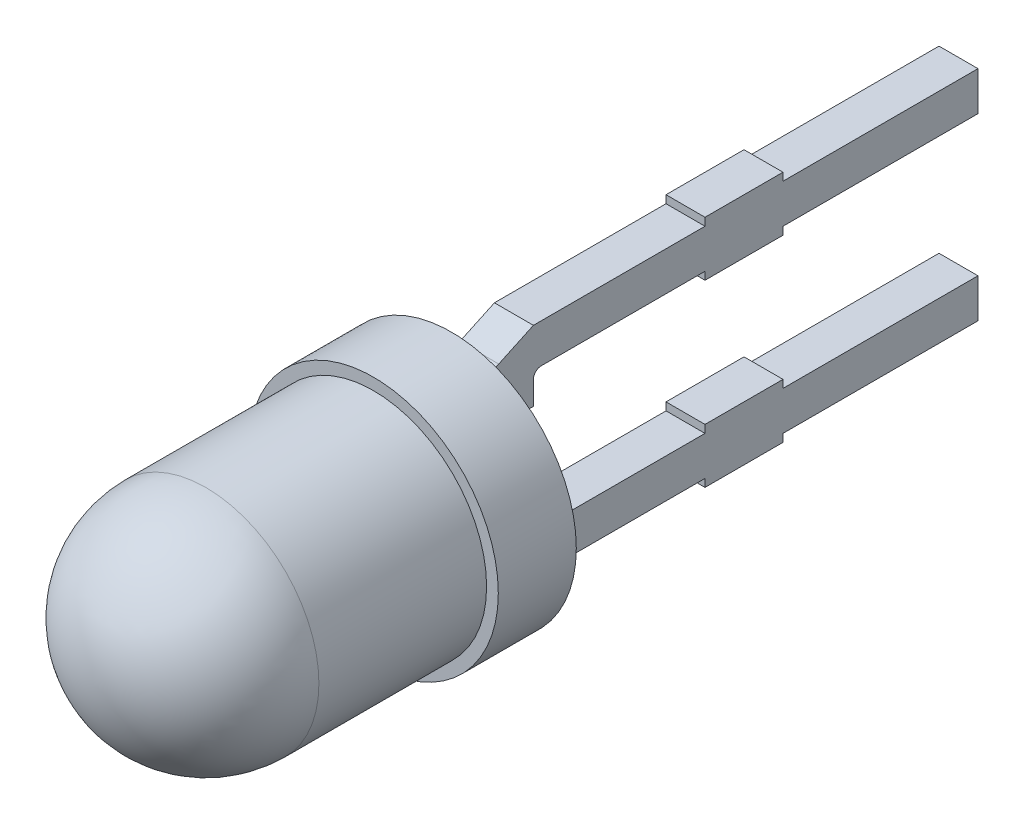
from build123d import *

# Parameters (mm, degrees)
EXTRUDE1_DEPTH          = 0.25
FILLET1_R               = 0.25
CUT_EXTRUDE1_DEPTH      = 31.234789562
CUT_EXTRUDE1_DEPTH_BACK = 31.234789562
SKETCH3_W               = 12
SKETCH3_H               = 2.8
CUT_EXTRUDE2_DEPTH      = 19.290502996
CUT_EXTRUDE2_DEPTH_BACK = 19.290502996
SKETCH4_W               = 10.526019401
SKETCH4_H               = 5.000282968


with BuildPart() as part:
    # Sketch1 → Revolve1 (revolve)
    with BuildSketch(Plane(origin=(0, 0, 0), x_dir=(0, 0, -1), z_dir=(1, 0, 0))):
        with BuildLine():
            Line((0, 1.45), (2.15, 1.45))
            Line((2.15, 1.45), (2.15, 1.599999975))
            Line((2.15, 1.599999975), (3.15, 1.599999975))
            Line((3.15, 1.599999975), (3.15, 0))
            Line((3.15, 0), (-1.45, 0))
            ThreePointArc((-1.45, 0), (-1.025304833, 1.025304833), (0, 1.45))
        make_face()
    revolve(axis=Axis((0, 0, 0), (0, 0, -1)))

    # Sketch2 → Extrude1 (add, symmetric)
    with BuildSketch(Plane(origin=(0, 0, 0), x_dir=(0, 0, -1), z_dir=(1, 0, 0))):
        with BuildLine():
            Line((3.15, 1.026953873), (3.95, 1.4))
            Line((3.95, 1.4), (6.15, 1.4))
            Line((6.15, 1.4), (6.15, 1.5))
            Line((6.15, 1.5), (7.15, 1.5))
            Line((7.15, 1.5), (7.15, 1.4))
            Line((7.15, 1.4), (30.15, 1.4))
            Line((30.15, 1.4), (30.15, 0.9))
            Line((30.15, 0.9), (7.15, 0.9))
            Line((7.15, 0.9), (7.15, 0.8))
            Line((7.15, 0.8), (6.15, 0.8))
            Line((6.15, 0.8), (6.15, 0.9))
            Line((6.15, 0.9), (4.05, 0.9))
            ThreePointArc((4.05, 0.9), (3.979289322, 0.870710678), (3.95, 0.8))
            Line((3.95, 0.8), (3.95, 0.5))
            Line((3.95, 0.5), (3.15, 0.5))
            Line((3.15, 0.5), (3.15, 1.026953873))
        make_face()
        with BuildLine():
            Line((3.95, -0.8), (3.95, -0.5))
            Line((3.95, -0.5), (3.15, -0.5))
            Line((3.15, -0.5), (3.15, -1.026953873))
            Line((3.15, -1.026953873), (3.95, -1.4))
            Line((3.95, -1.4), (6.15, -1.4))
            Line((6.15, -1.4), (6.15, -1.5))
            Line((6.15, -1.5), (7.15, -1.5))
            Line((7.15, -1.5), (7.15, -1.4))
            Line((7.15, -1.4), (30.15, -1.4))
            Line((30.15, -1.4), (30.15, -0.9))
            Line((30.15, -0.9), (7.15, -0.9))
            Line((7.15, -0.9), (7.15, -0.8))
            Line((7.15, -0.8), (6.15, -0.8))
            Line((6.15, -0.8), (6.15, -0.9))
            Line((6.15, -0.9), (4.05, -0.9))
            ThreePointArc((4.05, -0.9), (3.979289322, -0.870710678), (3.95, -0.8))
        make_face()
    extrude(amount=EXTRUDE1_DEPTH, both=True)

    # Fillet1
    fillet1_edges = [part.edges().sort_by_distance(p)[0] for p in [
        (0, -0.5, -3.15),
        (0, -1.026953873, -3.15),
        (-0.25, -0.763476937, -3.15),
        (0, 0.5, -3.15),
        (-0.25, 0.763476937, -3.15),
        (0, 1.026953873, -3.15),
        (0.25, 0.763476937, -3.15),
        (0.25, -0.763476937, -3.15),
    ]]
    fillet(fillet1_edges, radius=FILLET1_R)

    # Sketch3 → Cut-Extrude1 (cut, two sides: drawn at the far end of the back side and taken through both)
    with BuildSketch(Plane(origin=(0, 0, 0), x_dir=(0, 0, -1), z_dir=(1, 0, 0)).offset(-CUT_EXTRUDE1_DEPTH_BACK)):
        with Locations((24.15, 0)):
            Rectangle(SKETCH3_W, SKETCH3_H)
    extrude(amount=CUT_EXTRUDE1_DEPTH + CUT_EXTRUDE1_DEPTH_BACK, mode=Mode.SUBTRACT)

    # Sketch4 → Cut-Extrude2 (cut, two sides: drawn at the far end of the back side and taken through both)
    with BuildSketch(Plane(origin=(0, 0, 0), x_dir=(0, 0, -1), z_dir=(1, 0, 0)).offset(-CUT_EXTRUDE2_DEPTH_BACK)):
        with Locations((14.913009701, 0.067800447)):
            Rectangle(SKETCH4_W, SKETCH4_H)
    extrude(amount=CUT_EXTRUDE2_DEPTH + CUT_EXTRUDE2_DEPTH_BACK, mode=Mode.SUBTRACT)


solid = part.part
